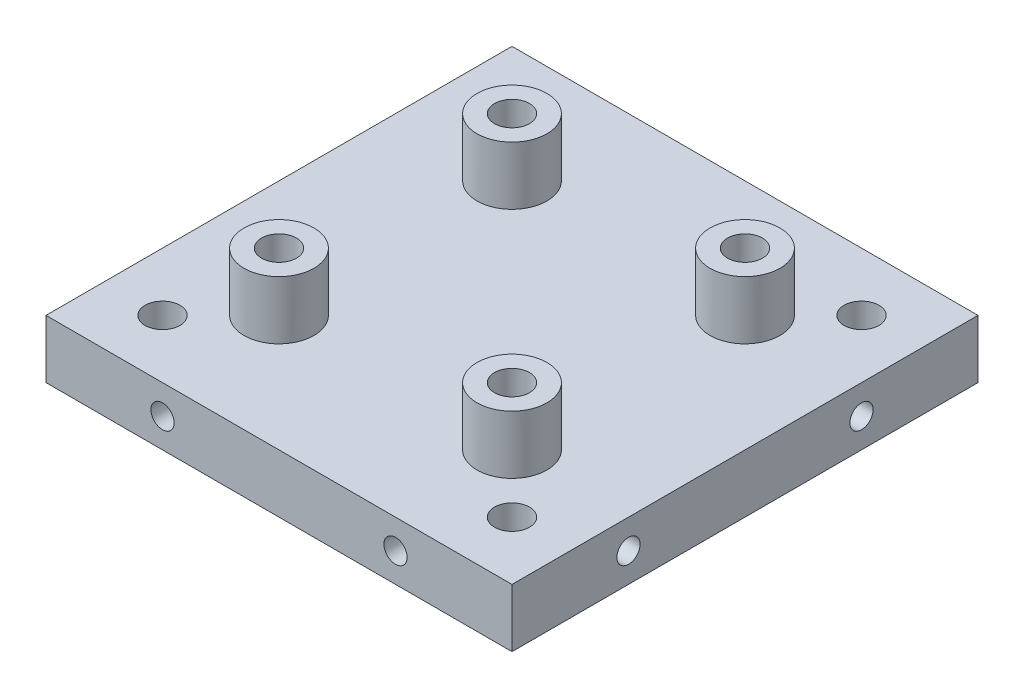
from build123d import *
from build123d.topology import SkipClean

# Parameters (mm, degrees)
SKETCH1_W           = 40
SKETCH1_H           = 40
BOSS_EXTRUDE1_DEPTH = 5
SKETCH3_R           = 1.0000000000000007
BOSS_EXTRUDE3_DEPTH = 5
SKETCH3_4_R         = 1.0000000000000018
CUT_EXTRUDE1_DEPTH  = 5
SKETCH4_R           = 0.9999999999999998
CUT_EXTRUDE2_DEPTH  = 10
CIRPATTERN2_COUNT   = 4
SKETCH6_R           = 1.4999999999999987
CUT_EXTRUDE5_DEPTH  = 47.00000000000001
SKETCH9_W           = 40
SKETCH9_H           = 5
CUT_EXTRUDE6_DEPTH  = 47.00000000000001
SKETCH10_R          = 3.0000000000000004
SKETCH10_R_2        = 1.4999999999999987
SKETCH10_R_3        = 3.0000000000000013
BOSS_EXTRUDE4_DEPTH = 5


with BuildPart() as part:
    # Sketch1 → Boss-Extrude1 (new body)
    with BuildSketch(Plane(origin=(0, 0, 0), x_dir=(1, 0, 0), z_dir=(0, 1, 0))):
        Rectangle(SKETCH1_W, SKETCH1_H)
    extrude(amount=BOSS_EXTRUDE1_DEPTH)

    # Sketch3 → Boss-Extrude3 (add)
    # profile 1 of 4: a face of its own
    with BuildSketch(Plane(origin=(0, 5, 0), x_dir=(1, 0, 0), z_dir=(0, 1, 0))):
        with BuildLine():
            Line((10.999999999999996, 11), (18, 11))
            Line((18, 11), (18, 3.999999999999993))
            Line((18, 3.9999999999999933), (19.999999999999996, 3.9999999999999933))
            Line((19.999999999999996, 3.999999999999993), (19.999999999999996, 13))
            Line((19.999999999999996, 13), (19.000000000000004, 13))
            Line((19.000000000000004, 12.999999999999783), (19.000000000000004, 16))
            ThreePointArc((19, 16), (16, 19), (13, 16))
            Line((13.000000000000002, 16), (13.000000000000002, 12.999999999999783))
            Line((13.000000000000002, 13), (10.999999999999996, 13))
            Line((10.999999999999996, 13), (10.999999999999996, 11))
        make_face()
        with Locations((16, 16)):
            Circle(SKETCH3_R, mode=Mode.SUBTRACT)
    # profile 2 of 4: a face of its own
    with BuildSketch(Plane(origin=(0, 5, 0), x_dir=(1, 0, 0), z_dir=(0, 1, 0))):
        with BuildLine():
            Line((-18, 11), (-11.000000000000004, 11))
            Line((-11.000000000000004, 11), (-11.000000000000004, 12.999999999999783))
            Line((-11.000000000000004, 12.999999999999783), (-13, 12.999999999999735))
            Line((-13, 12.999999999999783), (-13, 16))
            ThreePointArc((-13, 16), (-16, 19), (-19, 16))
            Line((-19, 16), (-19, 12.999999999999783))
            Line((-19, 12.999999999999591), (-19.999999999999595, 12.999999999999567))
            Line((-19.999999999999595, 12.999999999999567), (-19.999999999999595, 9.000000000000004))
            Line((-19.999999999999996, 9.000000000000004), (-18, 9.000000000000004))
            Line((-18, 9.000000000000004), (-18, 11))
        make_face()
        with BuildLine():
            ThreePointArc((-17, 16), (-16, 17), (-14.999999999999998, 16))
            Line((-14.999999999999998, 16), (-17, 16))
        make_face(mode=Mode.SUBTRACT)
    # profile 3 of 4: a face of its own
    with BuildSketch(Plane(origin=(0, 5, 0), x_dir=(1, 0, 0), z_dir=(0, 1, 0))):
        with BuildLine():
            Line((20.000000000000174, -4.000000000000002), (18, -4.000000000000002))
            Line((18, -4.000000000000002), (18, -11))
            Line((18, -11), (11.000000000000334, -11))
            Line((11.000000000000334, -11), (11.00000000000038, -12.999999999999595))
            Line((11.00000000000038, -12.999999999999595), (13.000000000000307, -12.999999999999595))
            Line((13.000000000000307, -13.000000000000002), (13.000000000000307, -16.00000000000022))
            ThreePointArc((13, -16), (16, -19), (19, -16))
            Line((19.00000000000031, -16.00000000000022), (19.00000000000031, -13.000000000000002))
            Line((19.00000000000031, -12.999999999999593), (19.999999999999968, -12.999999999999593))
            Line((19.999999999999968, -12.999999999999593), (20.000000000000174, -4.000000000000002))
        make_face()
    # profile 4 of 4: a face of its own
    with BuildSketch(Plane(origin=(0, 5, 0), x_dir=(1, 0, 0), z_dir=(0, 1, 0))):
        with BuildLine():
            Line((-10.999999999999826, -13.000000000000224), (-10.999999999999826, -11))
            Line((-10.999999999999826, -11), (-18, -11))
            Line((-18, -11), (-18, -8.999999999999996))
            Line((-18, -8.999999999999996), (-19.999999999999996, -8.999999999999996))
            Line((-19.9999999999996, -8.999999999999996), (-19.999999999999414, -12.99999999999981))
            Line((-19.999999999999414, -12.99999999999981), (-18.999999999999698, -12.999999999999856))
            Line((-18.999999999999698, -13.000000000000002), (-18.999999999999698, -16.00000000000022))
            ThreePointArc((-19, -16), (-16, -19), (-13, -16))
            Line((-12.999999999999698, -16.00000000000022), (-12.999999999999698, -13.000000000000002))
            Line((-12.999999999999698, -13.000000000000131), (-10.999999999999826, -13.000000000000224))
        make_face()
        with BuildLine():
            ThreePointArc((-14.999999999999998, -16), (-16, -17), (-17, -16))
            Line((-17, -16.00000000000022), (-14.999999999999998, -16.00000000000022))
        make_face(mode=Mode.SUBTRACT)
    extrude(amount=BOSS_EXTRUDE3_DEPTH)

    # Sketch3<4> → Cut-Extrude1 (cut)
    with SkipClean():  # the faces are left unmerged after this step: merging them gives an invalid solid
        with BuildSketch(Plane(origin=(0, 5, 0), x_dir=(1, 0, 0), z_dir=(0, 1, 0))):
            with Locations((-16, 16)):
                Circle(SKETCH3_4_R)
            with Locations((-16, -16)):
                Circle(SKETCH3_4_R)
            with Locations((16, -16)):
                Circle(SKETCH3_4_R)
        extrude(amount=CUT_EXTRUDE1_DEPTH, mode=Mode.SUBTRACT)

    # Sketch4 → Cut-Extrude2 (cut)
    with SkipClean():  # the faces are left unmerged after this step: merging them gives an invalid solid
        with BuildSketch(Plane.ZY.offset(20)):
            with Locations((-10, 2.5)):
                Circle(SKETCH4_R)
            with Locations((10, 2.5)):
                Circle(SKETCH4_R)
        cut_extrude2 = extrude(amount=-CUT_EXTRUDE2_DEPTH, mode=Mode.SUBTRACT)

    # CirPattern2: Cut-Extrude2 ×4 about axis
    with SkipClean():  # the faces are left unmerged after this step: merging them gives an invalid solid
        cirpattern2_axis = Axis((0, 0, 0), (0, -1, 0))
        for i in range(1, CIRPATTERN2_COUNT):
            add(cut_extrude2.rotate(cirpattern2_axis, i * 360 / CIRPATTERN2_COUNT), mode=Mode.SUBTRACT)

    # Sketch6 → Cut-Extrude5 (cut)
    with BuildSketch(Plane.XZ):
        with Locations((-14.999999999999998, 15)):
            Circle(SKETCH6_R)
        with Locations((15.000000000000002, 15)):
            Circle(SKETCH6_R)
        with Locations((-14.999999999999998, -14.999999999999998)):
            Circle(SKETCH6_R)
        with Locations((15.000000000000002, -14.999999999999998)):
            Circle(SKETCH6_R)
    extrude(amount=-CUT_EXTRUDE5_DEPTH, mode=Mode.SUBTRACT)

    # Sketch9 → Cut-Extrude6 (cut)
    with BuildSketch(Plane.XY.offset(20)):
        with Locations((0, 7.5)):
            Rectangle(SKETCH9_W, SKETCH9_H)
    extrude(amount=-CUT_EXTRUDE6_DEPTH, mode=Mode.SUBTRACT)

    # Sketch10 → Boss-Extrude4 (add)
    # profile 1 of 4: a face of its own
    with BuildSketch(Plane(origin=(0, 5, 0), x_dir=(1, 0, 0), z_dir=(0, 1, 0))):
        with Locations((-10, 10)):
            Circle(SKETCH10_R)
        with Locations((-10, 10)):
            Circle(SKETCH10_R_2, mode=Mode.SUBTRACT)
    # profile 2 of 4: a face of its own
    with BuildSketch(Plane(origin=(0, 5, 0), x_dir=(1, 0, 0), z_dir=(0, 1, 0))):
        with Locations((10, 10)):
            Circle(SKETCH10_R_3)
        with Locations((10, 10)):
            Circle(SKETCH10_R_2, mode=Mode.SUBTRACT)
    # profile 3 of 4: a face of its own
    with BuildSketch(Plane(origin=(0, 5, 0), x_dir=(1, 0, 0), z_dir=(0, 1, 0))):
        with Locations((-10, -10)):
            Circle(SKETCH10_R)
        with Locations((-10, -10)):
            Circle(SKETCH10_R_2, mode=Mode.SUBTRACT)
    # profile 4 of 4: a face of its own
    with BuildSketch(Plane(origin=(0, 5, 0), x_dir=(1, 0, 0), z_dir=(0, 1, 0))):
        with Locations((10, -10)):
            Circle(SKETCH10_R_3)
        with Locations((10, -10)):
            Circle(SKETCH10_R_2, mode=Mode.SUBTRACT)
    extrude(amount=BOSS_EXTRUDE4_DEPTH)


solid = part.part
